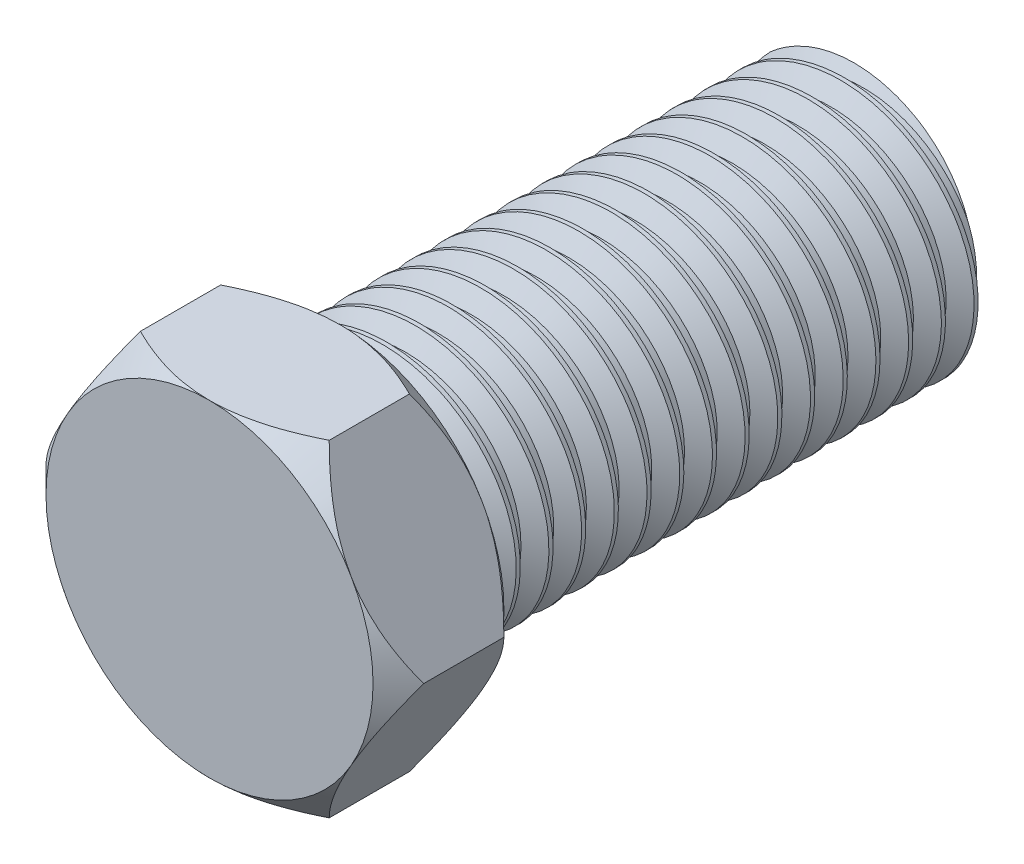
from build123d import *

# Parameters (mm, degrees)
BOSS_EXTRUDE1_DEPTH      = 1
BOSS_EXTRUDE2_DEPTH      = 1
BOSS_EXTRUDE2_DEPTH_BACK = 4
SKETCH1_3_R              = 1
THREAD1_PITCH            = 0.25
SKETCH1_8_OUTSIDE_W      = 8.144
SKETCH1_8_OUTSIDE_H      = 7.758
SKETCH1_8_OUTSIDE_R      = 1.25
CUT_EXTRUDE3_DEPTH       = 1
CUT_EXTRUDE3_DRAFT       = 45
SKETCH8_OUTSIDE_W        = 8.144
SKETCH8_OUTSIDE_H        = 7.758
SKETCH8_OUTSIDE_R        = 1.25
CUT_EXTRUDE4_DEPTH       = 1
CUT_EXTRUDE4_DRAFT       = -45


with BuildPart() as part:
    # Sketch1 → Boss-Extrude1 (new body)
    with BuildSketch(Plane.XY):
        Polygon((1.443375673, 0), (0.721687836, 1.25), (-0.721687836, 1.25), (-1.443375673, 0), (-0.721687836, -1.25), (0.721687836, -1.25), align=None)
    extrude(amount=BOSS_EXTRUDE1_DEPTH)

    # Sketch1<3> → Boss-Extrude2 (add, two sides: drawn at the far end of the back side and taken through both)
    with BuildSketch(Plane.XY.offset(-BOSS_EXTRUDE2_DEPTH_BACK)):
        Circle(SKETCH1_3_R)
    extrude(amount=BOSS_EXTRUDE2_DEPTH + BOSS_EXTRUDE2_DEPTH_BACK)

    # Thread1: the profile of Thread Profile2 profile screwed along a right-hand helix of 16 turns, 6 arcs to a turn; built about Z, then put on its axis
    thread1_z = Axis((0, 0, 0), (0, 0, 1))
    thread1_corners = [(1.0003, 0, -0.000173205), (1.0003, 0, 0.218923204), (0.864683531, 0, 0.140625), (0.864683531, 0, 0.078125)]
    with BuildLine(mode=Mode.PRIVATE) as thread1_profile:
        Line(thread1_corners[0], thread1_corners[1])
        Line(thread1_corners[1], thread1_corners[2])
        Line(thread1_corners[2], thread1_corners[3])
        Line(thread1_corners[3], thread1_corners[0])
    thread1_cap = Face(thread1_profile.wire())
    thread1_turn_angles = [0, 30, 60, 90, 120, 150, 180, 210, 240, 270, 300, 330, 360]
    thread1_turn_weights = [1, 0.8660254037844387, 1, 0.8660254037844387, 1, 0.8660254037844387, 1, 0.8660254037844387, 1, 0.8660254037844387, 1, 0.8660254037844387, 1]
    thread1_turn_rails = [Edge.make_bspline([Vector(p[0], p[1], 0).rotate(thread1_z, thread1_turn_angles[k]) / thread1_turn_weights[k] + Vector(0, 0, p[2] + THREAD1_PITCH * thread1_turn_angles[k] / 360) for k in range(13)], [0, 0, 0, 1, 1, 2, 2, 3, 3, 4, 4, 5, 5, 6, 6, 6], 2, thread1_turn_weights) for p in thread1_corners]
    thread1_turn_sides = [Face.make_surface_from_curves(thread1_turn_rails[p[0]], thread1_turn_rails[p[1]]) for p in [(0, 1), (1, 2), (2, 3), (3, 0)]]
    thread1 = Plane(origin=(0, 0, 0), x_dir=(-1, 0, 0), z_dir=(0, 0, -1)) * Solid(Shell([*[p.moved(Location((0, 0, THREAD1_PITCH * i))) for i in range(16) for p in thread1_turn_sides], thread1_cap, thread1_cap.rotate(thread1_z, 5760).moved(Location((0, 0, THREAD1_PITCH * 5760 / 360)))]))
    add(thread1, mode=Mode.SUBTRACT)


with BuildPart() as cut_extrude3_tool:
    # Sketch1<8> outside → Cut-Extrude3 (with draft: the straight prism first)
    with BuildSketch(Plane.XY):
        Rectangle(SKETCH1_8_OUTSIDE_W, SKETCH1_8_OUTSIDE_H)
        Circle(SKETCH1_8_OUTSIDE_R, mode=Mode.SUBTRACT)
    extrude(amount=CUT_EXTRUDE3_DEPTH)
    # Cut-Extrude3: the draft: its side faces are tilted about the plane it starts from
    cut_extrude3_sides = [cut_extrude3_tool.faces().sort_by_distance(p)[0] for p in [
        (0, -3.879, 0.5),
        (4.072, 0, 0.5),
        (0, 3.879, 0.5),
        (-4.072, 0, 0.5),
        (-1.25, 0, 0.5),
    ]]
    draft(cut_extrude3_sides, Plane.XY, CUT_EXTRUDE3_DRAFT)


with BuildPart() as part_1:
    add(part.part)

    # Cut-Extrude3: cut by cut_extrude3_tool
    add(cut_extrude3_tool.part, mode=Mode.SUBTRACT)


with BuildPart() as cut_extrude4_tool:
    # Sketch8 outside → Cut-Extrude4 (with draft: the straight prism first)
    with BuildSketch(Plane.XY.offset(1)):
        Rectangle(SKETCH8_OUTSIDE_W, SKETCH8_OUTSIDE_H)
        Circle(SKETCH8_OUTSIDE_R, mode=Mode.SUBTRACT)
    extrude(amount=-CUT_EXTRUDE4_DEPTH)
    # Cut-Extrude4: the draft: its side faces are tilted about the plane it starts from
    cut_extrude4_sides = [cut_extrude4_tool.faces().sort_by_distance(p)[0] for p in [
        (0, -3.879, 0.5),
        (4.072, 0, 0.5),
        (0, 3.879, 0.5),
        (-4.072, 0, 0.5),
        (-1.25, 0, 0.5),
    ]]
    draft(cut_extrude4_sides, Plane.XY.offset(1), CUT_EXTRUDE4_DRAFT)


with BuildPart() as part_2:
    add(part_1.part)

    # Cut-Extrude4: cut by cut_extrude4_tool
    add(cut_extrude4_tool.part, mode=Mode.SUBTRACT)


solid = part_2.part
